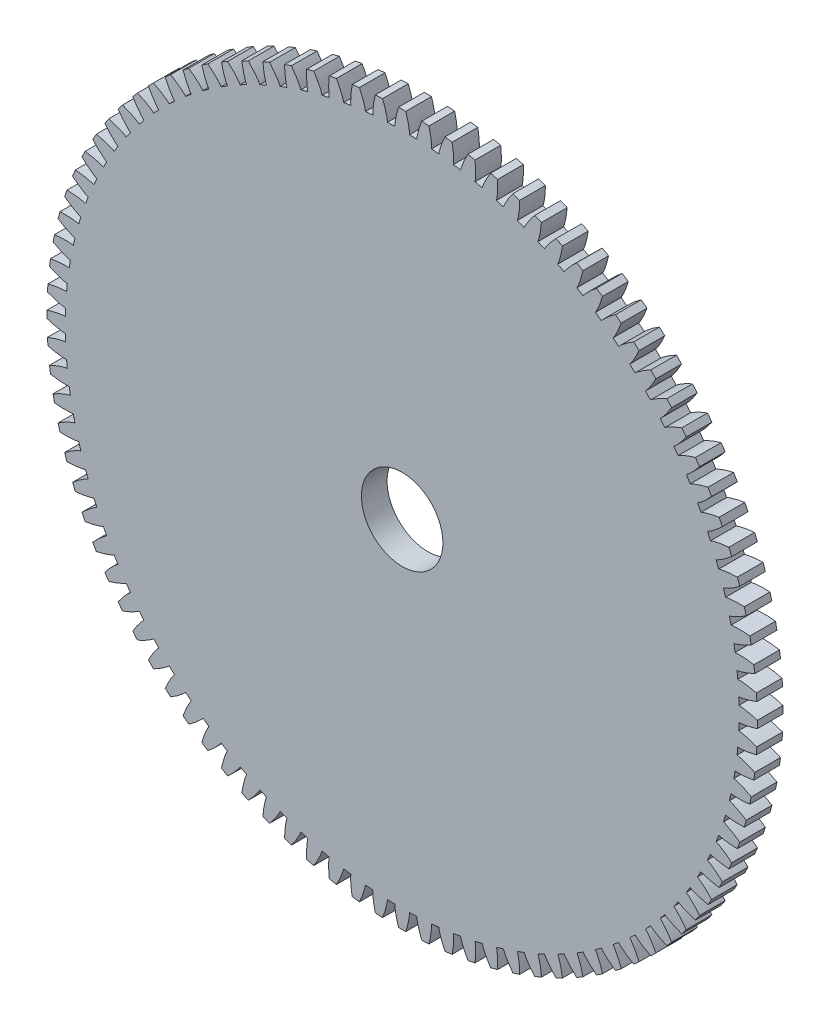
from build123d import *

# Parameters (mm, degrees)
SKETCH1_R               = 41.486666667
BOSS_EXTRUDE1_DEPTH     = 3
CUT_EXTRUDE2_DEPTH      = 4
CIRPATTERN1_COUNT       = 96
CUT_EXTRUDE4_DEPTH      = 5
CUT_EXTRUDE4_DEPTH_BACK = 5
SKETCH3_R               = 4.7625


with BuildPart() as part:
    # Sketch1 → Boss-Extrude1 (new body)
    with BuildSketch(Plane.XY):
        Circle(SKETCH1_R)
    extrude(amount=BOSS_EXTRUDE1_DEPTH)

    # Sketch2 → Cut-Extrude2 (cut, symmetric)
    with BuildSketch(Plane.XY):
        with BuildLine():
            add(Edge.make_bspline(
                [(39.336078935, 0.861885347), (39.345201333, 0.862020681), (39.362459718, 0.861902685), (39.390645333, 0.861305704), (39.429844436, 0.859746028), (39.476363786, 0.857221258), (39.531241939, 0.85337642), (39.591643963, 0.8482375), (39.657469214, 0.841658563), (39.723244691, 0.834219919), (39.788964098, 0.825982971), (39.854529767, 0.817040209), (39.934075026, 0.805333681), (40.029634133, 0.790080584), (40.141606423, 0.770473386), (40.268943363, 0.746132176), (40.399123086, 0.719062736), (40.527559176, 0.690564963), (40.657749914, 0.659618237), (40.784018422, 0.628149679), (40.915650178, 0.593240403), (41.037390606, 0.55988902), (41.174352905, 0.520045747), (41.285044182, 0.487170587), (41.399890052, 0.45113191), (41.455862, 0.433284233), (41.484499599, 0.424033174)],
                knots=[0, 0, 0, 0, 0, 0.015083688, 0.02853182, 0.04661014, 0.06485485, 0.092110526, 0.119476176, 0.146842496, 0.174208854, 0.201574956, 0.228941013, 0.256307345, 0.307035032, 0.361767352, 0.416499661, 0.471231937, 0.525964282, 0.580696616, 0.635428982, 0.690161387, 0.744893688, 0.799626082, 0.854358407, 0.909090914, 0.909090914, 0.909090914, 0.909090914, 0.909090914], degree=4))
            Line((41.484499599, 0.424033174), (59.996865883, 0.613257042))
            add(Edge.make_bspline(
                [(59.996865883, 0.613257042), (59.996592062, 0.640045874), (59.996012817, 0.692221525), (59.994462642, 0.823662983), (59.992883334, 0.924222134), (59.990570757, 1.069613826), (59.988257163, 1.188037858), (59.985503462, 1.322730006), (59.982571572, 1.447602339), (59.979308978, 1.578346223), (59.975798035, 1.705633629), (59.97200551, 1.834816416), (59.967924092, 1.963146568), (59.963603578, 2.091468893), (59.958939024, 2.220623133), (59.954117455, 2.347867633), (59.948822005, 2.478544969), (59.943580576, 2.603341696), (59.937519093, 2.737925557), (59.932082431, 2.856247351), (59.924880986, 3.001478998), (59.919880029, 3.101926136), (59.912830202, 3.233187554), (59.909995756, 3.285289377), (59.908516917, 3.312038762)],
                knots=[0.083333333, 0.083333333, 0.083333333, 0.083333333, 0.083333333, 0.123015873, 0.162698413, 0.202380952, 0.242063492, 0.281746032, 0.321428571, 0.361111111, 0.400793651, 0.44047619, 0.48015873, 0.51984127, 0.55952381, 0.599206349, 0.638888889, 0.678571429, 0.718253968, 0.757936508, 0.797619048, 0.837301587, 0.876984127, 0.916666667, 0.916666667, 0.916666667, 0.916666667, 0.916666667], degree=4))
            Line((59.908516917, 3.312038762), (41.423411197, 2.290090801))
            add(Edge.make_bspline(
                [(39.308227369, 1.71266267), (39.317339086, 1.713124259), (39.334552803, 1.714370754), (39.362639025, 1.716809885), (39.401652192, 1.720929966), (39.447906814, 1.72649184), (39.502416003, 1.733917649), (39.562352601, 1.742996048), (39.627606632, 1.753866077), (39.692754768, 1.765590716), (39.757794742, 1.778108283), (39.822635146, 1.791320097), (39.901244449, 1.808204069), (39.995601356, 1.829674373), (40.106051532, 1.856562929), (40.231523843, 1.889180257), (40.359654416, 1.9247059), (40.48595167, 1.96154278), (40.613839647, 2.000938128), (40.737779663, 2.040597665), (40.866846409, 2.084041326), (40.986144897, 2.125283507), (41.120208074, 2.173999235), (41.228512214, 2.214043563), (41.340755148, 2.257516357), (41.395439962, 2.278986562), (41.423411197, 2.290090801)],
                knots=[0, 0, 0, 0, 0, 0.015083688, 0.02853182, 0.04661014, 0.06485485, 0.092110526, 0.119476176, 0.146842496, 0.174208854, 0.201574956, 0.228941013, 0.256307345, 0.307035032, 0.361767352, 0.416499661, 0.471231937, 0.525964282, 0.580696616, 0.635428982, 0.690161387, 0.744893688, 0.799626082, 0.854358407, 0.909090914, 0.909090914, 0.909090914, 0.909090914, 0.909090914], degree=4))
            Line((39.308227369, 1.71266267), (39.336078935, 0.861885347))
        make_face()
    cut_extrude2 = extrude(amount=CUT_EXTRUDE2_DEPTH, both=True, mode=Mode.SUBTRACT)

    # CirPattern1: Cut-Extrude2 ×96 about axis
    cirpattern1_axis = Axis((0, 0, -0.15), (0, 0, 1))
    for i in range(1, CIRPATTERN1_COUNT):
        add(cut_extrude2.rotate(cirpattern1_axis, i * 360 / CIRPATTERN1_COUNT), mode=Mode.SUBTRACT)

    # Sketch3 → Cut-Extrude4 (cut, two sides: drawn at the far end of the back side and taken through both)
    with BuildSketch(Plane.XY.offset(-CUT_EXTRUDE4_DEPTH_BACK)):
        Circle(SKETCH3_R)
    extrude(amount=CUT_EXTRUDE4_DEPTH + CUT_EXTRUDE4_DEPTH_BACK, mode=Mode.SUBTRACT)


solid = part.part
